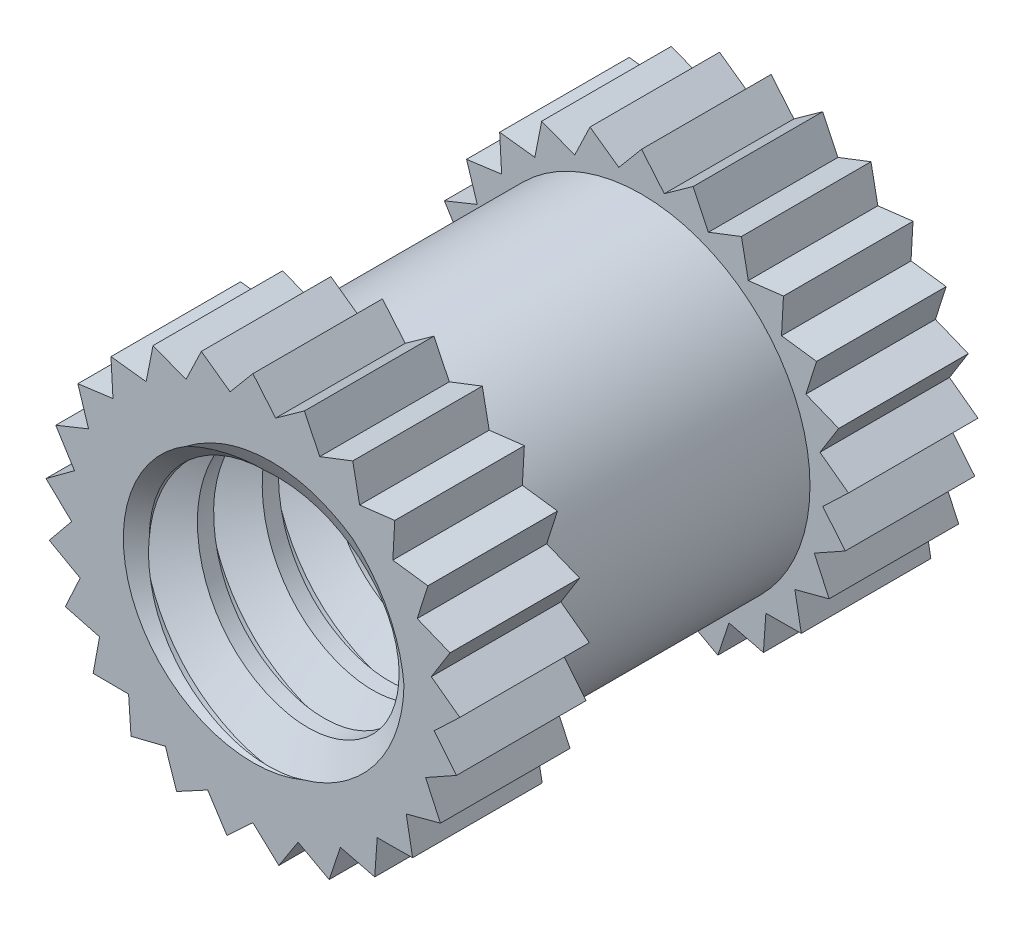
from build123d import *

# Parameters (mm, degrees)
SKETCH1_R             = 1.3
BOSS_EXTRUDE1_DEPTH   = 2
THREAD1_PITCH         = 0.5
BOSS_EXTRUDE2_DEPTH   = 1
CIRPATTERN1_COUNT     = 25
MIRROR1_COPY_1_DEPTH  = 1
MIRROR1_COPY_2_DEPTH  = 1
MIRROR1_COPY_3_DEPTH  = 1
MIRROR1_COPY_4_DEPTH  = 1
MIRROR1_COPY_5_DEPTH  = 1
MIRROR1_COPY_6_DEPTH  = 1
MIRROR1_COPY_7_DEPTH  = 1
MIRROR1_COPY_8_DEPTH  = 1
MIRROR1_COPY_9_DEPTH  = 1
MIRROR1_COPY_10_DEPTH = 1
MIRROR1_COPY_11_DEPTH = 1
MIRROR1_COPY_12_DEPTH = 1
MIRROR1_COPY_13_DEPTH = 1
MIRROR1_COPY_14_DEPTH = 1
MIRROR1_COPY_15_DEPTH = 1
MIRROR1_COPY_16_DEPTH = 1
MIRROR1_COPY_17_DEPTH = 1
MIRROR1_COPY_18_DEPTH = 1
MIRROR1_COPY_19_DEPTH = 1
MIRROR1_COPY_20_DEPTH = 1
MIRROR1_COPY_21_DEPTH = 1
MIRROR1_COPY_22_DEPTH = 1
MIRROR1_COPY_23_DEPTH = 1
MIRROR1_COPY_24_DEPTH = 1


with BuildPart() as part:
    # Sketch1 → Boss-Extrude1 (new, symmetric)
    with BuildSketch(Plane.XY):
        Circle(SKETCH1_R)
    extrude(amount=BOSS_EXTRUDE1_DEPTH, both=True)

    # Sketch3 → Tap Drill for M3x0.5 Tap1 (revolve, cut)
    with BuildSketch(Plane(origin=(0, 0, 2), x_dir=(0, -1, 0), z_dir=(1, 0, 0))):
        Polygon((0, 0), (0, 4), (1, 4), (0.9, 3.9), (0.9, 0.1), (1, 0), align=None)
    revolve(axis=Axis((0, 0, 8.35), (0, 0, -1)), mode=Mode.SUBTRACT)

    # Thread1: the profile of Thread Profile1 profile screwed along a right-hand helix of 16 turns, 6 arcs to a turn; built about Z, then put on its axis
    thread1_z = Axis((0, 0, 0), (0, 0, 1))
    thread1_corners = [(0.8997, 0, -0.000173205), (1.170632937, 0, 0.156249999), (1.170632937, 0, 0.218749999), (0.8997, 0, 0.375173204)]
    with BuildLine(mode=Mode.PRIVATE) as thread1_profile:
        Line(thread1_corners[0], thread1_corners[1])
        Line(thread1_corners[1], thread1_corners[2])
        Line(thread1_corners[2], thread1_corners[3])
        Line(thread1_corners[3], thread1_corners[0])
    thread1_cap = Face(thread1_profile.wire())
    thread1_turn_angles = [0, 30, 60, 90, 120, 150, 180, 210, 240, 270, 300, 330, 360]
    thread1_turn_weights = [1, 0.8660254037844387, 1, 0.8660254037844387, 1, 0.8660254037844387, 1, 0.8660254037844387, 1, 0.8660254037844387, 1, 0.8660254037844387, 1]
    thread1_turn_rails = [Edge.make_bspline([Vector(p[0], p[1], 0).rotate(thread1_z, thread1_turn_angles[k]) / thread1_turn_weights[k] + Vector(0, 0, p[2] + THREAD1_PITCH * thread1_turn_angles[k] / 360) for k in range(13)], [0, 0, 0, 1, 1, 2, 2, 3, 3, 4, 4, 5, 5, 6, 6, 6], 2, thread1_turn_weights) for p in thread1_corners]
    thread1_turn_sides = [Face.make_surface_from_curves(thread1_turn_rails[p[0]], thread1_turn_rails[p[1]]) for p in [(0, 1), (1, 2), (2, 3), (3, 0)]]
    thread1 = Plane(origin=(0, 0, 2.9), x_dir=(-1, 0, 0), z_dir=(0, 0, -1)) * Solid(Shell([*[p.moved(Location((0, 0, THREAD1_PITCH * i))) for i in range(16) for p in thread1_turn_sides], thread1_cap, thread1_cap.rotate(thread1_z, 5760).moved(Location((0, 0, THREAD1_PITCH * 5760 / 360)))]))
    add(thread1, mode=Mode.SUBTRACT)

    # Sketch6 → Boss-Extrude2 (add)
    with BuildSketch(Plane.XY.offset(2)):
        with BuildLine():
            Line((0, 1.6), (-0.276731151, 1.270204657))
            ThreePointArc((-0.276731151, 1.270204657), (0, 1.3), (0.276731151, 1.270204657))
            Line((0.276731151, 1.270204657), (0, 1.6))
        make_face()
    boss_extrude2 = extrude(amount=-BOSS_EXTRUDE2_DEPTH)

    # CirPattern1: Boss-Extrude2 ×25 about axis
    cirpattern1_axis = Axis((0, 0, 0), (0, 0, 1))
    for i in range(1, CIRPATTERN1_COUNT):
        add(boss_extrude2.rotate(cirpattern1_axis, i * 360 / CIRPATTERN1_COUNT))

    # Mirror1: Boss-Extrude2 across plane
    add(boss_extrude2.mirror(Plane.XY))

    # Mirror1 copy 1 sketch → Mirror1 copy 1 (add)
    with BuildSketch(Plane(origin=(0, 0, -2), x_dir=(0.9685831611286311, 0.2486898871648548, 0), z_dir=(0, 0, -1))):
        with BuildLine():
            Line((0, -1.6), (-0.276731151, -1.270204657))
            ThreePointArc((-0.276731151, -1.270204657), (0, -1.3), (0.276731151, -1.270204657))
            Line((0.276731151, -1.270204657), (0, -1.6))
        make_face()
    extrude(amount=-MIRROR1_COPY_1_DEPTH)

    # Mirror1 copy 2 sketch → Mirror1 copy 2 (add)
    with BuildSketch(Plane(origin=(0, 0, -2), x_dir=(0.8763066800438636, 0.4817536741017153, 0), z_dir=(0, 0, -1))):
        with BuildLine():
            Line((0, -1.6), (-0.276731151, -1.270204657))
            ThreePointArc((-0.276731151, -1.270204657), (0, -1.3), (0.276731151, -1.270204657))
            Line((0.276731151, -1.270204657), (0, -1.6))
        make_face()
    extrude(amount=-MIRROR1_COPY_2_DEPTH)

    # Mirror1 copy 3 sketch → Mirror1 copy 3 (add)
    with BuildSketch(Plane(origin=(0, 0, -2), x_dir=(0.7289686274214116, 0.6845471059286887, 0), z_dir=(0, 0, -1))):
        with BuildLine():
            Line((0, -1.6), (-0.276731151, -1.270204657))
            ThreePointArc((-0.276731151, -1.270204657), (0, -1.3), (0.276731151, -1.270204657))
            Line((0.276731151, -1.270204657), (0, -1.6))
        make_face()
    extrude(amount=-MIRROR1_COPY_3_DEPTH)

    # Mirror1 copy 4 sketch → Mirror1 copy 4 (add)
    with BuildSketch(Plane(origin=(0, 0, -2), x_dir=(0.5358267949789965, 0.8443279255020151, 0), z_dir=(0, 0, -1))):
        with BuildLine():
            Line((0, -1.6), (-0.276731151, -1.270204657))
            ThreePointArc((-0.276731151, -1.270204657), (0, -1.3), (0.276731151, -1.270204657))
            Line((0.276731151, -1.270204657), (0, -1.6))
        make_face()
    extrude(amount=-MIRROR1_COPY_4_DEPTH)

    # Mirror1 copy 5 sketch → Mirror1 copy 5 (add)
    with BuildSketch(Plane(origin=(0, 0, -2), x_dir=(0.30901699437494745, 0.9510565162951535, 0), z_dir=(0, 0, -1))):
        with BuildLine():
            Line((0, -1.6), (-0.276731151, -1.270204657))
            ThreePointArc((-0.276731151, -1.270204657), (0, -1.3), (0.276731151, -1.270204657))
            Line((0.276731151, -1.270204657), (0, -1.6))
        make_face()
    extrude(amount=-MIRROR1_COPY_5_DEPTH)

    # Mirror1 copy 6 sketch → Mirror1 copy 6 (add)
    with BuildSketch(Plane(origin=(0, 0, -2), x_dir=(0.0627905195293133, 0.9980267284282716, 0), z_dir=(0, 0, -1))):
        with BuildLine():
            Line((0, -1.6), (-0.276731151, -1.270204657))
            ThreePointArc((-0.276731151, -1.270204657), (0, -1.3), (0.276731151, -1.270204657))
            Line((0.276731151, -1.270204657), (0, -1.6))
        make_face()
    extrude(amount=-MIRROR1_COPY_6_DEPTH)

    # Mirror1 copy 7 sketch → Mirror1 copy 7 (add)
    with BuildSketch(Plane(origin=(0, 0, -2), x_dir=(-0.1873813145857246, 0.9822872507286887, 0), z_dir=(0, 0, -1))):
        with BuildLine():
            Line((0, -1.6), (-0.276731151, -1.270204657))
            ThreePointArc((-0.276731151, -1.270204657), (0, -1.3), (0.276731151, -1.270204657))
            Line((0.276731151, -1.270204657), (0, -1.6))
        make_face()
    extrude(amount=-MIRROR1_COPY_7_DEPTH)

    # Mirror1 copy 8 sketch → Mirror1 copy 8 (add)
    with BuildSketch(Plane(origin=(0, 0, -2), x_dir=(-0.4257792915650727, 0.9048270524660195, 0), z_dir=(0, 0, -1))):
        with BuildLine():
            Line((0, -1.6), (-0.276731151, -1.270204657))
            ThreePointArc((-0.276731151, -1.270204657), (0, -1.3), (0.276731151, -1.270204657))
            Line((0.276731151, -1.270204657), (0, -1.6))
        make_face()
    extrude(amount=-MIRROR1_COPY_8_DEPTH)

    # Mirror1 copy 9 sketch → Mirror1 copy 9 (add)
    with BuildSketch(Plane(origin=(0, 0, -2), x_dir=(-0.6374239897486897, 0.7705132427757893, 0), z_dir=(0, 0, -1))):
        with BuildLine():
            Line((0, -1.6), (-0.276731151, -1.270204657))
            ThreePointArc((-0.276731151, -1.270204657), (0, -1.3), (0.276731151, -1.270204657))
            Line((0.276731151, -1.270204657), (0, -1.6))
        make_face()
    extrude(amount=-MIRROR1_COPY_9_DEPTH)

    # Mirror1 copy 10 sketch → Mirror1 copy 10 (add)
    with BuildSketch(Plane(origin=(0, 0, -2), x_dir=(-0.8090169943749473, 0.5877852522924732, 0), z_dir=(0, 0, -1))):
        with BuildLine():
            Line((0, -1.6), (-0.276731151, -1.270204657))
            ThreePointArc((-0.276731151, -1.270204657), (0, -1.3), (0.276731151, -1.270204657))
            Line((0.276731151, -1.270204657), (0, -1.6))
        make_face()
    extrude(amount=-MIRROR1_COPY_10_DEPTH)

    # Mirror1 copy 11 sketch → Mirror1 copy 11 (add)
    with BuildSketch(Plane(origin=(0, 0, -2), x_dir=(-0.9297764858882515, 0.36812455268467775, 0), z_dir=(0, 0, -1))):
        with BuildLine():
            Line((0, -1.6), (-0.276731151, -1.270204657))
            ThreePointArc((-0.276731151, -1.270204657), (0, -1.3), (0.276731151, -1.270204657))
            Line((0.276731151, -1.270204657), (0, -1.6))
        make_face()
    extrude(amount=-MIRROR1_COPY_11_DEPTH)

    # Mirror1 copy 12 sketch → Mirror1 copy 12 (add)
    with BuildSketch(Plane(origin=(0, 0, -2), x_dir=(-0.9921147013144779, 0.1253332335643041, 0), z_dir=(0, 0, -1))):
        with BuildLine():
            Line((0, -1.6), (-0.276731151, -1.270204657))
            ThreePointArc((-0.276731151, -1.270204657), (0, -1.3), (0.276731151, -1.270204657))
            Line((0.276731151, -1.270204657), (0, -1.6))
        make_face()
    extrude(amount=-MIRROR1_COPY_12_DEPTH)

    # Mirror1 copy 13 sketch → Mirror1 copy 13 (add)
    with BuildSketch(Plane(origin=(0, 0, -2), x_dir=(-0.9921147013144779, -0.12533323356430429, 0), z_dir=(0, 0, -1))):
        with BuildLine():
            Line((0, -1.6), (-0.276731151, -1.270204657))
            ThreePointArc((-0.276731151, -1.270204657), (0, -1.3), (0.276731151, -1.270204657))
            Line((0.276731151, -1.270204657), (0, -1.6))
        make_face()
    extrude(amount=-MIRROR1_COPY_13_DEPTH)

    # Mirror1 copy 14 sketch → Mirror1 copy 14 (add)
    with BuildSketch(Plane(origin=(0, 0, -2), x_dir=(-0.9297764858882515, -0.3681245526846779, 0), z_dir=(0, 0, -1))):
        with BuildLine():
            Line((0, -1.6), (-0.276731151, -1.270204657))
            ThreePointArc((-0.276731151, -1.270204657), (0, -1.3), (0.276731151, -1.270204657))
            Line((0.276731151, -1.270204657), (0, -1.6))
        make_face()
    extrude(amount=-MIRROR1_COPY_14_DEPTH)

    # Mirror1 copy 15 sketch → Mirror1 copy 15 (add)
    with BuildSketch(Plane(origin=(0, 0, -2), x_dir=(-0.8090169943749476, -0.587785252292473, 0), z_dir=(0, 0, -1))):
        with BuildLine():
            Line((0, -1.6), (-0.276731151, -1.270204657))
            ThreePointArc((-0.276731151, -1.270204657), (0, -1.3), (0.276731151, -1.270204657))
            Line((0.276731151, -1.270204657), (0, -1.6))
        make_face()
    extrude(amount=-MIRROR1_COPY_15_DEPTH)

    # Mirror1 copy 16 sketch → Mirror1 copy 16 (add)
    with BuildSketch(Plane(origin=(0, 0, -2), x_dir=(-0.6374239897486895, -0.7705132427757894, 0), z_dir=(0, 0, -1))):
        with BuildLine():
            Line((0, -1.6), (-0.276731151, -1.270204657))
            ThreePointArc((-0.276731151, -1.270204657), (0, -1.3), (0.276731151, -1.270204657))
            Line((0.276731151, -1.270204657), (0, -1.6))
        make_face()
    extrude(amount=-MIRROR1_COPY_16_DEPTH)

    # Mirror1 copy 17 sketch → Mirror1 copy 17 (add)
    with BuildSketch(Plane(origin=(0, 0, -2), x_dir=(-0.42577929156507216, -0.9048270524660198, 0), z_dir=(0, 0, -1))):
        with BuildLine():
            Line((0, -1.6), (-0.276731151, -1.270204657))
            ThreePointArc((-0.276731151, -1.270204657), (0, -1.3), (0.276731151, -1.270204657))
            Line((0.276731151, -1.270204657), (0, -1.6))
        make_face()
    extrude(amount=-MIRROR1_COPY_17_DEPTH)

    # Mirror1 copy 18 sketch → Mirror1 copy 18 (add)
    with BuildSketch(Plane(origin=(0, 0, -2), x_dir=(-0.18738131458572463, -0.9822872507286887, 0), z_dir=(0, 0, -1))):
        with BuildLine():
            Line((0, -1.6), (-0.276731151, -1.270204657))
            ThreePointArc((-0.276731151, -1.270204657), (0, -1.3), (0.276731151, -1.270204657))
            Line((0.276731151, -1.270204657), (0, -1.6))
        make_face()
    extrude(amount=-MIRROR1_COPY_18_DEPTH)

    # Mirror1 copy 19 sketch → Mirror1 copy 19 (add)
    with BuildSketch(Plane(origin=(0, 0, -2), x_dir=(0.06279051952931372, -0.9980267284282716, 0), z_dir=(0, 0, -1))):
        with BuildLine():
            Line((0, -1.6), (-0.276731151, -1.270204657))
            ThreePointArc((-0.276731151, -1.270204657), (0, -1.3), (0.276731151, -1.270204657))
            Line((0.276731151, -1.270204657), (0, -1.6))
        make_face()
    extrude(amount=-MIRROR1_COPY_19_DEPTH)

    # Mirror1 copy 20 sketch → Mirror1 copy 20 (add)
    with BuildSketch(Plane(origin=(0, 0, -2), x_dir=(0.30901699437494723, -0.9510565162951536, 0), z_dir=(0, 0, -1))):
        with BuildLine():
            Line((0, -1.6), (-0.276731151, -1.270204657))
            ThreePointArc((-0.276731151, -1.270204657), (0, -1.3), (0.276731151, -1.270204657))
            Line((0.276731151, -1.270204657), (0, -1.6))
        make_face()
    extrude(amount=-MIRROR1_COPY_20_DEPTH)

    # Mirror1 copy 21 sketch → Mirror1 copy 21 (add)
    with BuildSketch(Plane(origin=(0, 0, -2), x_dir=(0.5358267949789968, -0.844327925502015, 0), z_dir=(0, 0, -1))):
        with BuildLine():
            Line((0, -1.6), (-0.276731151, -1.270204657))
            ThreePointArc((-0.276731151, -1.270204657), (0, -1.3), (0.276731151, -1.270204657))
            Line((0.276731151, -1.270204657), (0, -1.6))
        make_face()
    extrude(amount=-MIRROR1_COPY_21_DEPTH)

    # Mirror1 copy 22 sketch → Mirror1 copy 22 (add)
    with BuildSketch(Plane(origin=(0, 0, -2), x_dir=(0.7289686274214119, -0.6845471059286883, 0), z_dir=(0, 0, -1))):
        with BuildLine():
            Line((0, -1.6), (-0.276731151, -1.270204657))
            ThreePointArc((-0.276731151, -1.270204657), (0, -1.3), (0.276731151, -1.270204657))
            Line((0.276731151, -1.270204657), (0, -1.6))
        make_face()
    extrude(amount=-MIRROR1_COPY_22_DEPTH)

    # Mirror1 copy 23 sketch → Mirror1 copy 23 (add)
    with BuildSketch(Plane(origin=(0, 0, -2), x_dir=(0.8763066800438636, -0.4817536741017153, 0), z_dir=(0, 0, -1))):
        with BuildLine():
            Line((0, -1.6), (-0.276731151, -1.270204657))
            ThreePointArc((-0.276731151, -1.270204657), (0, -1.3), (0.276731151, -1.270204657))
            Line((0.276731151, -1.270204657), (0, -1.6))
        make_face()
    extrude(amount=-MIRROR1_COPY_23_DEPTH)

    # Mirror1 copy 24 sketch → Mirror1 copy 24 (add)
    with BuildSketch(Plane(origin=(0, 0, -2), x_dir=(0.9685831611286312, -0.2486898871648545, 0), z_dir=(0, 0, -1))):
        with BuildLine():
            Line((0, -1.6), (-0.276731151, -1.270204657))
            ThreePointArc((-0.276731151, -1.270204657), (0, -1.3), (0.276731151, -1.270204657))
            Line((0.276731151, -1.270204657), (0, -1.6))
        make_face()
    extrude(amount=-MIRROR1_COPY_24_DEPTH)


solid = part.part
